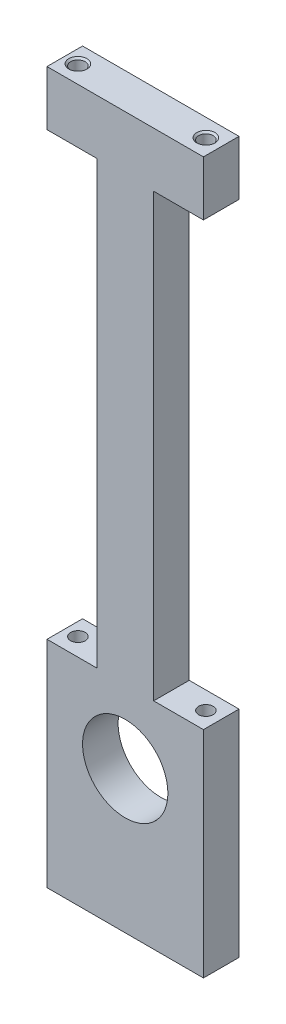
from build123d import *
from build123d.topology import SkipClean

# Parameters (mm, degrees)
EXTRUDE_1_DEPTH                = 5
EXTRUDE_2_DEPTH                = 5
EXTRUDE_START                  = -5
EXTRUDE_3_DEPTH                = 5
HOLE_WIZARD_M2_5_1_D           = 2.05
HOLE_WIZARD_M2_5_1_CSINK_D     = 2.55
HOLE_WIZARD_M2_5_1_CSINK_ANGLE = 90
SKETCH_7_W                     = 22
SKETCH_7_H                     = 10
EXTRUDE_4_DEPTH                = 5


with BuildPart() as part:
    # 草图1 → 凸台-拉伸1 (new body)
    with BuildSketch(Plane.XY):
        with BuildLine():
            Line((-6, 0), (-11, 0))
            Line((-11, 0), (-11, 10.250706887))
            Line((-11, 10.250706887), (11, 10.250706887))
            Line((11, 10.250706887), (11, 0))
            Line((11, 0), (6, 0))
            ThreePointArc((6, 0), (0, 6), (-6, 0))
        make_face()
    extrude(amount=EXTRUDE_1_DEPTH)

    # 草图2 → 凸台-拉伸2 (add)
    with BuildSketch(Plane.XY.offset(5)):
        Polygon((4, 72.311119812), (4, 10.250706887), (-4, 10.250706887), (-4, 72.311119812), (-11, 72.311119812), (-11, 80), (11, 80), (11, 72.311119812), align=None)
    extrude(amount=-EXTRUDE_2_DEPTH)

    # 草图6 → 凸台-拉伸3 (add)
    with SkipClean():  # the faces are left unmerged after this step: merging them gives an invalid solid
        with BuildSketch(Plane(origin=(0, 0, 0), x_dir=(-1, 0, 0), z_dir=(0, 0, -1)).offset(EXTRUDE_START)):
            with BuildLine():
                Line((-11, 0), (-11, -10))
                Line((-11, -10), (11, -10))
                Line((11, -10), (11, 0))
                Line((11, 0), (6, 0))
                ThreePointArc((6, 0), (0, -6), (-6, 0))
                Line((-6, 0), (-11, 0))
            make_face()
        extrude(amount=EXTRUDE_3_DEPTH)
    add(part.part.scale(1), mode=Mode.REPLACE)  # the faces are merged on a copy

    # M2.5 螺纹孔1 (through all)
    with Locations(Plane(origin=(0, 80, 0), x_dir=(1, 0, 0), z_dir=(0, 1, 0))):
        with Locations((-9.154712184, -2.5), (8.845287816, -2.5)):
            CounterSinkHole(HOLE_WIZARD_M2_5_1_D / 2, HOLE_WIZARD_M2_5_1_CSINK_D / 2, counter_sink_angle=HOLE_WIZARD_M2_5_1_CSINK_ANGLE)

    # 草图7 → 凸台-拉伸4 (add)
    with BuildSketch(Plane.XY.offset(5)):
        with Locations((0, -15)):
            Rectangle(SKETCH_7_W, SKETCH_7_H)
    extrude(amount=-EXTRUDE_4_DEPTH)


solid = part.part
